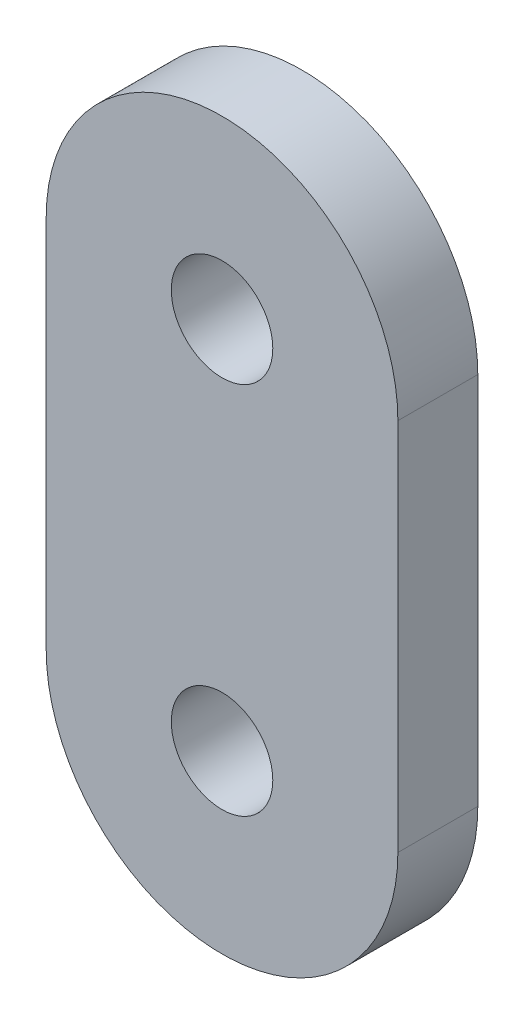
from build123d import *

# Parameters (mm, degrees)
SKETCH1_R           = 3.175
BOSS_EXTRUDE1_DEPTH = 5


with BuildPart() as part:
    # Sketch1 → Boss-Extrude1 (new body)
    with BuildSketch(Plane.XY):
        with BuildLine():
            Line((11, 0), (11, 23.393))
            ThreePointArc((11, 23.393), (0, 34.393), (-11, 23.393))
            Line((-11, 23.393), (-11, 0))
            ThreePointArc((-11, 0), (0, -11), (11, 0))
        make_face()
        Circle(SKETCH1_R, mode=Mode.SUBTRACT)
        with Locations((0, 23.393)):
            Circle(SKETCH1_R, mode=Mode.SUBTRACT)
    extrude(amount=BOSS_EXTRUDE1_DEPTH)


solid = part.part
